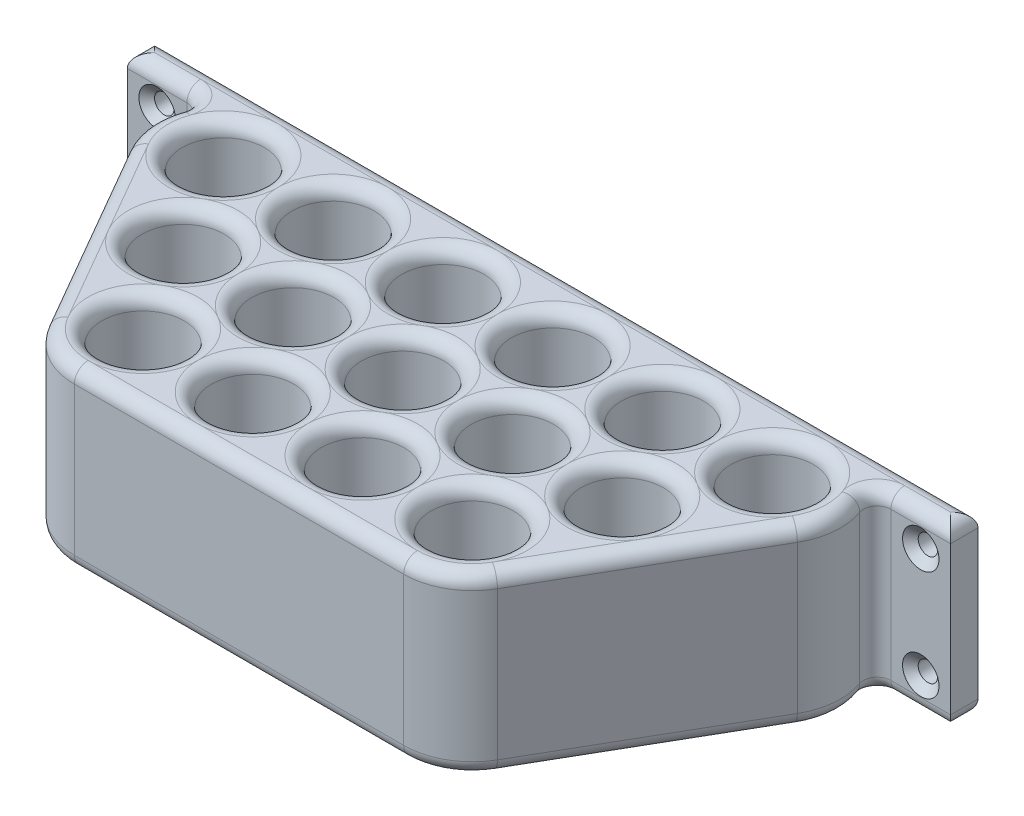
from build123d import *

# Parameters (mm, degrees)
SKETCH1_R                                         = 9.525
BOSS_EXTRUDE1_DEPTH                               = 19.05
BOSS_EXTRUDE2_DEPTH                               = 2.54
SKETCH3_W                                         = 190.5
SKETCH3_H                                         = 40.64
BOSS_EXTRUDE3_DEPTH                               = 6.35
FILLET1_R                                         = 3.175
CSK_FOR_8_FLAT_HEAD_MACHINE_SCREW_100_D           = 4.4958
CSK_FOR_8_FLAT_HEAD_MACHINE_SCREW_100_CSINK_D     = 8.4328
CSK_FOR_8_FLAT_HEAD_MACHINE_SCREW_100_CSINK_ANGLE = 100


with BuildPart() as part:
    # Sketch1 → Boss-Extrude1 (new, symmetric)
    with BuildSketch(Plane(origin=(0, 0, 0), x_dir=(1, 0, 0), z_dir=(0, 1, 0))):
        with BuildLine():
            Line((-25.4, 59.869090512), (101.6, 59.869090512))
            ThreePointArc((101.6, 59.869090512), (115.348153285, 51.931590512), (115.348153285, 36.056590512))
            Line((115.348153285, 36.056590512), (89.948153285, -7.9375))
            ThreePointArc((89.948153285, -7.9375), (84.1375, -13.748153285), (76.2, -15.875))
            Line((76.2, -15.875), (0, -15.875))
            ThreePointArc((0, -15.875), (-7.9375, -13.748153285), (-13.748153285, -7.9375))
            Line((-13.748153285, -7.9375), (-39.148153285, 36.056590512))
            ThreePointArc((-39.148153285, 36.056590512), (-39.148153285, 51.931590512), (-25.4, 59.869090512))
        make_face()
        with Locations(Location((0, 0, 0), (0, 0, 90))):
            Circle(SKETCH1_R, mode=Mode.SUBTRACT)
        with Locations(Location((-12.7, 21.997045256, 0), (0, 0, 90))):
            Circle(SKETCH1_R, mode=Mode.SUBTRACT)
        with Locations(Location((12.7, 21.997045256, 0), (0, 0, 90))):
            Circle(SKETCH1_R, mode=Mode.SUBTRACT)
        with Locations(Location((-25.4, 43.994090512, 0), (0, 0, 90))):
            Circle(SKETCH1_R, mode=Mode.SUBTRACT)
        with Locations(Location((0, 43.994090512, 0), (0, 0, 90))):
            Circle(SKETCH1_R, mode=Mode.SUBTRACT)
        with Locations(Location((25.4, 43.994090512, 0), (0, 0, 90))):
            Circle(SKETCH1_R, mode=Mode.SUBTRACT)
        with Locations(Location((50.8, 43.994090512, 0), (0, 0, 90))):
            Circle(SKETCH1_R, mode=Mode.SUBTRACT)
        with Locations(Location((38.1, 21.997045256, 0), (0, 0, 90))):
            Circle(SKETCH1_R, mode=Mode.SUBTRACT)
        with Locations(Location((25.4, 0, 0), (0, 0, 90))):
            Circle(SKETCH1_R, mode=Mode.SUBTRACT)
        with Locations(Location((76.2, 43.994090512, 0), (0, 0, 90))):
            Circle(SKETCH1_R, mode=Mode.SUBTRACT)
        with Locations(Location((63.5, 21.997045256, 0), (0, 0, 90))):
            Circle(SKETCH1_R, mode=Mode.SUBTRACT)
        with Locations(Location((50.8, 0, 0), (0, 0, 90))):
            Circle(SKETCH1_R, mode=Mode.SUBTRACT)
        with Locations(Location((101.6, 43.994090512, 0), (0, 0, 90))):
            Circle(SKETCH1_R, mode=Mode.SUBTRACT)
        with Locations(Location((88.9, 21.997045256, 0), (0, 0, 90))):
            Circle(SKETCH1_R, mode=Mode.SUBTRACT)
        with Locations(Location((76.2, 0, 0), (0, 0, 90))):
            Circle(SKETCH1_R, mode=Mode.SUBTRACT)
    extrude(amount=BOSS_EXTRUDE1_DEPTH, both=True)

    # Sketch2 → Boss-Extrude2 (add)
    with BuildSketch(Plane.XZ.offset(19.05)):
        with BuildLine():
            Line((-25.4, -59.869090512), (101.6, -59.869090512))
            ThreePointArc((101.6, -59.869090512), (115.348153285, -51.931590512), (115.348153285, -36.056590512))
            Line((115.348153285, -36.056590512), (89.948153285, 7.9375))
            ThreePointArc((89.948153285, 7.9375), (84.1375, 13.748153285), (76.2, 15.875))
            Line((76.2, 15.875), (0, 15.875))
            ThreePointArc((0, 15.875), (-7.9375, 13.748153285), (-13.748153285, 7.9375))
            Line((-13.748153285, 7.9375), (-39.148153285, -36.056590512))
            ThreePointArc((-39.148153285, -36.056590512), (-39.148153285, -51.931590512), (-25.4, -59.869090512))
        make_face()
    extrude(amount=BOSS_EXTRUDE2_DEPTH)

    # Sketch3 → Boss-Extrude3 (add)
    with BuildSketch(Plane(origin=(0, 0, -59.869090512), x_dir=(-1, 0, 0), z_dir=(0, 0, -1))):
        with Locations((-38.1, -1.27)):
            Rectangle(SKETCH3_W, SKETCH3_H)
    extrude(amount=-BOSS_EXTRUDE3_DEPTH)

    # Fillet1
    fillet1_edges = [part.edges().sort_by_distance(p)[0] for p in [
        (117.446480038, -21.59, -44.945245279),
        (-7.9375, 19.05, 13.748153285),
        (-41.246480038, 19.05, -44.945245279),
        (-47.625, -21.59, -53.519090512),
        (-57.15, -21.59, -56.694090512),
        (123.825, -21.59, -53.519090512),
        (-47.625, 19.05, -53.519090512),
        (-57.15, 19.05, -56.694090512),
        (133.35, -21.59, -56.694090512),
        (123.825, 19.05, -53.519090512),
        (133.35, 19.05, -56.694090512),
        (-38.1, -1.27, -53.519090512),
        (114.3, -1.27, -53.519090512),
        (38.1, 19.05, 15.875),
        (84.1375, 19.05, 13.748153285),
        (0, -19.05, 9.525),
        (0, 19.05, 9.525),
        (102.648153285, 19.05, -14.059545256),
        (-12.7, -19.05, -12.472045256),
        (-12.7, 19.05, -12.472045256),
        (117.446480038, 19.05, -44.945245279),
        (12.7, -19.05, -12.472045256),
        (12.7, 19.05, -12.472045256),
        (38.1, 19.05, -59.869090512),
        (-25.4, -19.05, -34.469090512),
        (-25.4, 19.05, -34.469090512),
        (0, -19.05, -34.469090512),
        (0, 19.05, -34.469090512),
        (25.4, -19.05, -34.469090512),
        (25.4, 19.05, -34.469090512),
        (25.4, -19.05, 9.525),
        (25.4, 19.05, 9.525),
        (38.1, -19.05, -12.472045256),
        (38.1, 19.05, -12.472045256),
        (50.8, -19.05, -34.469090512),
        (50.8, 19.05, -34.469090512),
        (50.8, -19.05, 9.525),
        (50.8, 19.05, 9.525),
        (63.5, -19.05, -12.472045256),
        (63.5, 19.05, -12.472045256),
        (76.2, -19.05, -34.469090512),
        (76.2, 19.05, -34.469090512),
        (76.2, -19.05, 9.525),
        (76.2, 19.05, 9.525),
        (88.9, -19.05, -12.472045256),
        (88.9, 19.05, -12.472045256),
        (101.6, -19.05, -34.469090512),
        (101.6, 19.05, -34.469090512),
        (-26.448153285, 19.05, -14.059545256),
        (-41.246480038, -21.59, -44.945245279),
        (38.1, -21.59, -59.869090512),
        (102.648153285, -21.59, -14.059545256),
        (84.1375, -21.59, 13.748153285),
        (38.1, -21.59, 15.875),
        (-7.9375, -21.59, 13.748153285),
        (-26.448153285, -21.59, -14.059545256),
    ]]
    fillet(fillet1_edges, radius=FILLET1_R - 0.0001)  # a hair under: the kernel refuses the full size

    # CSK for #8 Flat Head Machine Screw (100)1 (through all)
    with Locations(Plane(origin=(-50.255256121, 11.43, -53.519090512), x_dir=(1, 0, 0), z_dir=(0, 0, 1))):
        with Locations((0, 0), (0, -25.4)):
            csk_for_8_flat_head_machine_screw_100 = CounterSinkHole(CSK_FOR_8_FLAT_HEAD_MACHINE_SCREW_100_D / 2, CSK_FOR_8_FLAT_HEAD_MACHINE_SCREW_100_CSINK_D / 2, counter_sink_angle=CSK_FOR_8_FLAT_HEAD_MACHINE_SCREW_100_CSINK_ANGLE)

    # Mirror1: CSK for #8 Flat Head Machine Screw (100)1 across plane
    add(csk_for_8_flat_head_machine_screw_100.mirror(Plane.ZY.offset(-38.1)), mode=Mode.SUBTRACT)


solid = part.part
